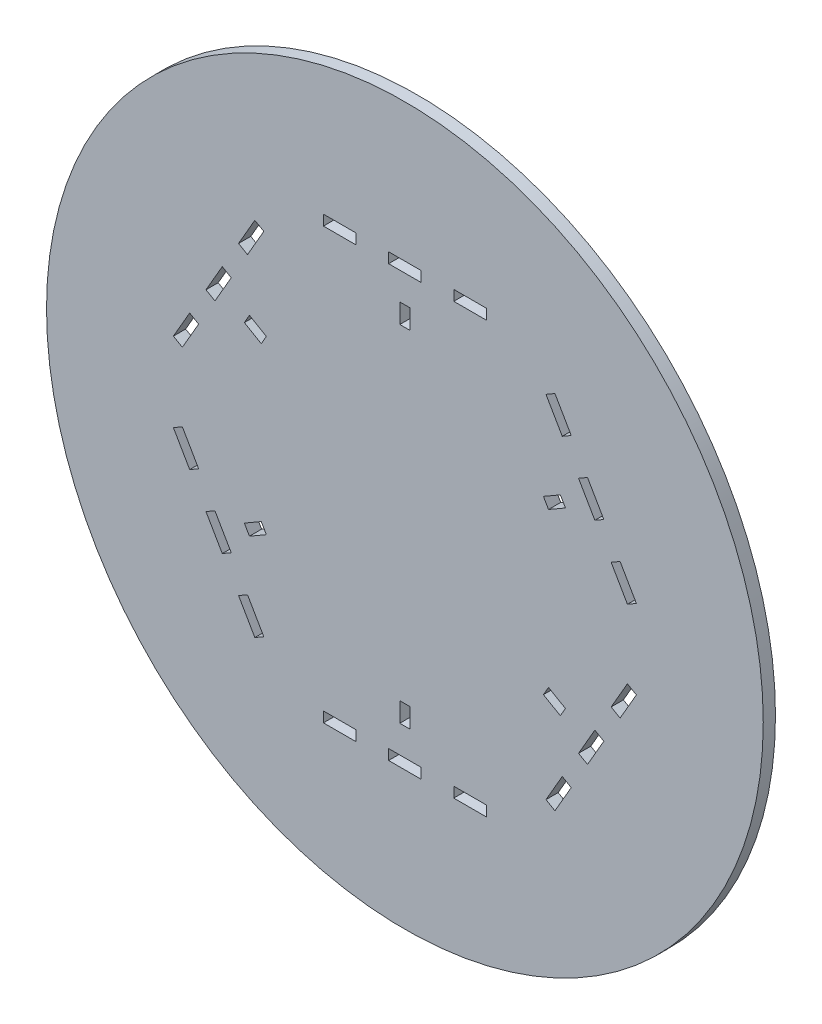
from build123d import *

# Parameters (mm, degrees)
SKETCH1_R           = 110
SKETCH1_W           = 10
SKETCH1_H           = 3.175
SKETCH1_W_2         = 3.125
SKETCH1_H_2         = 6
BOSS_EXTRUDE1_DEPTH = 1.875


with BuildPart() as part:
    # Sketch1 → Boss-Extrude1 (new, symmetric)
    with BuildSketch(Plane.XY):
        Circle(SKETCH1_R)
        with Locations((0, 66.025)):
            Rectangle(SKETCH1_W, SKETCH1_H, mode=Mode.SUBTRACT)
        with Locations((-20, 66.025)):
            Rectangle(SKETCH1_W, SKETCH1_H, mode=Mode.SUBTRACT)
        with Locations((20, 66.025)):
            Rectangle(SKETCH1_W, SKETCH1_H, mode=Mode.SUBTRACT)
        with Locations((0, 53)):
            Rectangle(SKETCH1_W_2, SKETCH1_H_2, mode=Mode.SUBTRACT)
        Polygon((61.054142613, 29.476122981), (56.054142613, 38.136377019), (53.304511956, 36.548877019), (58.304511956, 27.888622981), align=None, mode=Mode.SUBTRACT)
        Polygon((51.054142613, 46.796631057), (46.054142613, 55.456885095), (43.304511956, 53.869385095), (48.304511956, 45.209131057), align=None, mode=Mode.SUBTRACT)
        Polygon((71.054142613, 12.155614905), (68.304511956, 10.568114905), (63.304511956, 19.228368943), (66.054142613, 20.815868943), align=None, mode=Mode.SUBTRACT)
        Polygon((49.278672612, 26.646835307), (47.716172612, 29.353164693), (42.520020189, 26.353164693), (44.082520189, 23.646835307), align=None, mode=Mode.SUBTRACT)
        Polygon((56.054142613, -38.136377019), (61.054142613, -29.476122981), (58.304511956, -27.888622981), (53.304511956, -36.548877019), align=None, mode=Mode.SUBTRACT)
        Polygon((66.054142613, -20.815868943), (71.054142613, -12.155614905), (68.304511956, -10.568114905), (63.304511956, -19.228368943), align=None, mode=Mode.SUBTRACT)
        Polygon((46.054142613, -55.456885095), (43.304511956, -53.869385095), (48.304511956, -45.209131057), (51.054142613, -46.796631057), align=None, mode=Mode.SUBTRACT)
        Polygon((47.716172612, -29.353164693), (49.278672612, -26.646835307), (44.082520189, -23.646835307), (42.520020189, -26.353164693), align=None, mode=Mode.SUBTRACT)
        with Locations((0, -66.025)):
            Rectangle(SKETCH1_W, SKETCH1_H, mode=Mode.SUBTRACT)
        with Locations((20, -66.025)):
            Rectangle(SKETCH1_W, SKETCH1_H, mode=Mode.SUBTRACT)
        with Locations((-20, -66.025)):
            Rectangle(SKETCH1_W, SKETCH1_H, mode=Mode.SUBTRACT)
        with Locations((0, -53)):
            Rectangle(SKETCH1_W_2, SKETCH1_H_2, mode=Mode.SUBTRACT)
        Polygon((-61.054142613, -29.476122981), (-56.054142613, -38.136377019), (-53.304511956, -36.548877019), (-58.304511956, -27.888622981), align=None, mode=Mode.SUBTRACT)
        Polygon((-51.054142613, -46.796631057), (-46.054142613, -55.456885095), (-43.304511956, -53.869385095), (-48.304511956, -45.209131057), align=None, mode=Mode.SUBTRACT)
        Polygon((-71.054142613, -12.155614905), (-68.304511956, -10.568114905), (-63.304511956, -19.228368943), (-66.054142613, -20.815868943), align=None, mode=Mode.SUBTRACT)
        Polygon((-49.278672612, -26.646835307), (-47.716172612, -29.353164693), (-42.520020189, -26.353164693), (-44.082520189, -23.646835307), align=None, mode=Mode.SUBTRACT)
        Polygon((-56.054142613, 38.136377019), (-61.054142613, 29.476122981), (-58.304511956, 27.888622981), (-53.304511956, 36.548877019), align=None, mode=Mode.SUBTRACT)
        Polygon((-66.054142613, 20.815868943), (-71.054142613, 12.155614905), (-68.304511956, 10.568114905), (-63.304511956, 19.228368943), align=None, mode=Mode.SUBTRACT)
        Polygon((-46.054142613, 55.456885095), (-43.304511956, 53.869385095), (-48.304511956, 45.209131057), (-51.054142613, 46.796631057), align=None, mode=Mode.SUBTRACT)
        Polygon((-47.716172612, 29.353164693), (-49.278672612, 26.646835307), (-44.082520189, 23.646835307), (-42.520020189, 26.353164693), align=None, mode=Mode.SUBTRACT)
    extrude(amount=BOSS_EXTRUDE1_DEPTH, both=True)


solid = part.part
